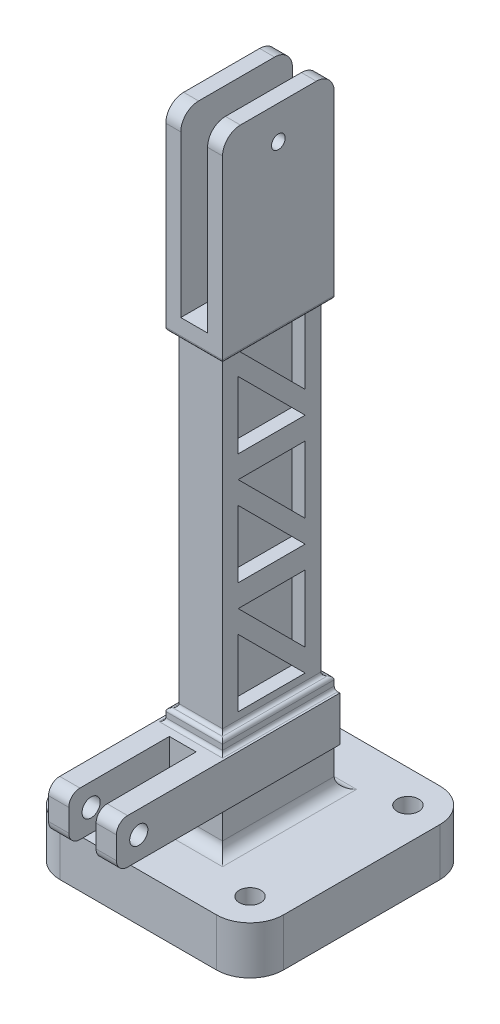
from build123d import *

# Parameters (mm, degrees)
SKETCH1_W               = 50
SKETCH1_H               = 50
BOSS_EXTRUDE1_DEPTH     = 12.7
SKETCH2_R               = 1.53
BOSS_EXTRUDE2_DEPTH     = 6.35
CUT_EXTRUDE2_DEPTH      = 155.110350074
CUT_EXTRUDE2_DEPTH_BACK = 155.110350074
SKETCH3_R               = 2.413
SKETCH4_R               = 2.032
BOSS_EXTRUDE4_DEPTH     = 7.6
CUT_EXTRUDE3_DEPTH      = 12.45
SKETCH6_W               = 6
SKETCH6_H               = 36
SKETCH6_H_2             = 4
CUT_EXTRUDE4_DEPTH      = 157.624551077
BOSS_EXTRUDE5_DEPTH     = 1
SKETCH14_W              = 50
SKETCH14_H              = 50
SKETCH14_W_2            = 12.7
SKETCH14_H_2            = 25
CUT_EXTRUDE9_DEPTH      = 2
CUT_EXTRUDE10_DEPTH     = 4.5
CUT_EXTRUDE6_START      = 22
SKETCH9_OUTSIDE_W       = 86.004
SKETCH9_OUTSIDE_H       = 98.504
SKETCH9_OUTSIDE_W_2     = 9.7
SKETCH9_OUTSIDE_H_2     = 22
CUT_EXTRUDE6_DEPTH      = 73
FILLET5_START           = -13
FILLET5_DEPTH           = 25.5
FILLET5_START_2         = -11.75
FILLET5_2_DEPTH         = 4.25
FILLET5_START_3         = 9.9315
FILLET5_3_DEPTH         = 1.8185
FILLET5_START_4         = 12.5
FILLET5_4_DEPTH         = 0.75
FILLET5_START_5         = -10.0685
FILLET5_5_DEPTH         = 21.268442308
FILLET5_START_6         = -12.5
FILLET5_6_DEPTH         = 25
FILLET5_START_7         = -8
FILLET5_7_DEPTH         = 16
FILLET5_START_8         = -5.6
FILLET5_8_DEPTH         = 0.75
FILLET5_START_9         = 4.85
FILLET5_9_DEPTH         = 0.75
FILLET1_R               = 2.5
FILLET6_R               = 7.5


with BuildPart() as part:
    # Sketch1 → Boss-Extrude1 (new body)
    with BuildSketch(Plane(origin=(0, 0, 0), x_dir=(1, 0, 0), z_dir=(0, 1, 0))):
        Rectangle(SKETCH1_W, SKETCH1_H)
    extrude(amount=BOSS_EXTRUDE1_DEPTH)

    # Sketch2 → Boss-Extrude2 (add, symmetric)
    with BuildSketch(Plane(origin=(0, 0, 0), x_dir=(0, 0, -1), z_dir=(1, 0, 0))):
        with BuildLine():
            Line((-12.5, 0), (12.5, 0))
            Line((12.5, 0), (12.5, 146))
            ThreePointArc((12.5, 146), (11.328427125, 148.828427125), (8.5, 150))
            Line((8.5, 150), (-8.5, 150))
            ThreePointArc((-8.5, 150), (-11.328427125, 148.828427125), (-12.5, 146))
            Line((-12.5, 146), (-12.5, 0))
        make_face()
        with Locations((0, 142.5)):
            Circle(SKETCH2_R, mode=Mode.SUBTRACT)
    extrude(amount=BOSS_EXTRUDE2_DEPTH, both=True)

    # Sketch3 → Cut-Extrude2 (cut, two sides: drawn at the far end of the back side and taken through both)
    with BuildSketch(Plane(origin=(0, 0, 0), x_dir=(1, 0, 0), z_dir=(0, 1, 0)).offset(-CUT_EXTRUDE2_DEPTH_BACK)):
        with Locations(Location((17.67766953, -17.67766953, 0), (0, 0, 270))):
            Circle(SKETCH3_R)
        with Locations(Location((17.67766953, 17.67766953, 0), (0, 0, 270))):
            Circle(SKETCH3_R)
        with Locations(Location((-17.67766953, 17.67766953, 0), (0, 0, 270))):
            Circle(SKETCH3_R)
        with Locations(Location((-17.67766953, -17.67766953, 0), (0, 0, 270))):
            Circle(SKETCH3_R)
    extrude(amount=CUT_EXTRUDE2_DEPTH + CUT_EXTRUDE2_DEPTH_BACK, mode=Mode.SUBTRACT)

    # Sketch4 → Boss-Extrude4 (add, symmetric)
    with BuildSketch(Plane(origin=(0, 0, 0), x_dir=(0, 0, -1), z_dir=(1, 0, 0))):
        with BuildLine():
            Line((12.5, 20), (-35, 20))
            ThreePointArc((-35, 20), (-36.767766953, 20.732233047), (-37.5, 22.5))
            Line((-37.5, 22.5), (-37.5, 27.5))
            ThreePointArc((-37.5, 27.5), (-36.767766953, 29.267766953), (-35, 30))
            Line((-35, 30), (12.5, 30))
            Line((12.5, 30), (12.5, 20))
        make_face()
        with Locations(Location((-32.5, 25, 0), (0, 0, 180))):
            Circle(SKETCH4_R, mode=Mode.SUBTRACT)
    extrude(amount=BOSS_EXTRUDE4_DEPTH, both=True)

    # Sketch5 → Cut-Extrude3 (cut)
    with BuildSketch(Plane(origin=(0, 30, 0), x_dir=(1, 0, 0), z_dir=(0, 1, 0))):
        Polygon((-3.070505438, -14.989300838), (-3.070505438, -44.384490964), (3.070505438, -44.384490964), (2.929494562, -14.989300838), align=None)
    extrude(amount=-CUT_EXTRUDE3_DEPTH, mode=Mode.SUBTRACT)

    # Sketch6 → Cut-Extrude4 (cut, through all)
    with BuildSketch(Plane.XY.offset(12.5)):
        with Locations((0, 128)):
            Rectangle(SKETCH6_W, SKETCH6_H)
        with Locations((0, 148)):
            Rectangle(SKETCH6_W, SKETCH6_H_2)
    extrude(amount=-CUT_EXTRUDE4_DEPTH, mode=Mode.SUBTRACT)

    # Sketch7 → Boss-Extrude5 (add)
    # profile 1 of 2: a face of its own
    with BuildSketch(Plane(origin=(-7.6, 17.6, 0), x_dir=(0, 1, 0), z_dir=(-1, 0, 0))):
        Polygon((8.560466437, 8.088778045), (8.560466437, 7.508205128), (5.420466437, 7.508205128), (5.420466437, 7.79), (8.238415155, 7.79), (8.238415155, 8.273076923), align=None)
    # profile 2 of 2: a face of its own
    with BuildSketch(Plane(origin=(-7.6, 17.6, 0), x_dir=(0, 1, 0), z_dir=(-1, 0, 0))):
        with BuildLine():
            Line((8.640979257, 4.891538462), (8.47051852, 4.67453125))
            Line((8.47051852, 4.67453125), (7.20181259, 5.504190705))
            add(Edge.make_bspline(
                [(7.20181259, 5.504190705), (7.210617025, 5.448953371), (7.227791071, 5.341206705), (7.2306242, 5.232144728), (7.232004898, 5.178994391)],
                knots=[0, 0, 0, 0, 1.025318673, 2, 2, 2, 2], degree=3))
            add(Edge.make_bspline(
                [(7.232004898, 5.178994391), (7.231147129, 5.14708078), (7.229458637, 5.084259786), (7.216464554, 4.992027398), (7.195987168, 4.90339961), (7.166137201, 4.818743764), (7.128006517, 4.737756003), (7.082307074, 4.659971567), (7.02667912, 4.586852621), (6.96453856, 4.517457563), (6.895712465, 4.454453824), (6.822683838, 4.39867302), (6.745528762, 4.351818127), (6.664286316, 4.313802666), (6.579081735, 4.284282289), (6.490024032, 4.262761945), (6.397051798, 4.250040824), (6.333822806, 4.248313384), (6.301704417, 4.247435897)],
                knots=[0, 0, 0, 0, 1.04369286, 2.054478336, 3.041073146, 4.015093852, 4.984733326, 5.965804835, 6.960378782, 7.985147595, 9.009457201, 10.008161701, 10.986880575, 11.956520048, 12.937015923, 13.931873656, 14.949455224, 16, 16, 16, 16], degree=3))
            add(Edge.make_bspline(
                [(6.301704417, 4.247435897), (6.257788747, 4.249074555), (6.171424054, 4.252297143), (6.04510866, 4.275756216), (5.925736546, 4.316241336), (5.8128386, 4.370405571), (5.709699594, 4.440679408), (5.61648959, 4.523957767), (5.535243379, 4.621027863), (5.465545639, 4.729591055), (5.410170872, 4.847090143), (5.369231176, 4.970291781), (5.344768668, 5.098142907), (5.341566016, 5.184971413), (5.339953616, 5.228685897)],
                knots=[0, 0, 0, 0, 1.031881447, 2.029301251, 3.006342947, 3.987068354, 4.962916383, 5.929513747, 6.915671209, 7.928552063, 8.953527267, 9.960179832, 10.973036711, 12, 12, 12, 12], degree=3))
            add(Edge.make_bspline(
                [(5.339953616, 5.228685897), (5.341324631, 5.270938374), (5.344040373, 5.354633133), (5.368232722, 5.477750435), (5.407444046, 5.59605085), (5.461465577, 5.708702825), (5.529697679, 5.813065349), (5.611852019, 5.906403803), (5.706112889, 5.988393443), (5.812769449, 6.056266358), (5.926640798, 6.111582969), (6.046458192, 6.150598574), (6.169810259, 6.175830068), (6.253777457, 6.178433248), (6.29604336, 6.17974359)],
                knots=[0, 0, 0, 0, 1.011913813, 2.004424092, 2.994488568, 3.992479987, 4.990471406, 5.973328987, 6.963763268, 7.974390938, 8.994854117, 9.989689954, 10.988086187, 12, 12, 12, 12], degree=3))
            add(Edge.make_bspline(
                [(6.29604336, 6.17974359), (6.328368726, 6.17860561), (6.394341577, 6.176283108), (6.494548343, 6.162422681), (6.596679591, 6.137000965), (6.683258949, 6.109489112), (6.754962343, 6.082189049), (6.811584619, 6.056875802), (6.871379561, 6.028572508), (6.93321579, 5.995397106), (6.998860099, 5.960228502), (7.065881481, 5.919147582), (7.136727763, 5.876279011), (7.183896117, 5.844874588), (7.208102655, 5.828758013)],
                knots=[0, 0, 0, 0, 1.17367173, 2.395347028, 3.66355231, 4.98980831, 5.690886799, 6.447442954, 7.240630024, 8.091733897, 8.994365608, 9.943299771, 10.944512865, 12, 12, 12, 12], degree=3))
            Line((7.208102655, 5.828758013), (8.640979257, 4.891538462))
        make_face()
        with BuildLine():
            add(Edge.make_bspline(
                [(6.909953616, 5.238120994), (6.909246353, 5.262040086), (6.907858709, 5.308969147), (6.900021286, 5.377734009), (6.885171517, 5.442639763), (6.865962999, 5.50442774), (6.839809258, 5.562453947), (6.808417354, 5.617380289), (6.771094432, 5.668661739), (6.728256634, 5.715397705), (6.682040535, 5.758312865), (6.632242388, 5.79522691), (6.580383613, 5.82710369), (6.525976801, 5.853012669), (6.469056852, 5.873190054), (6.409881813, 5.887784843), (6.348055881, 5.895907394), (6.306130144, 5.897258693), (6.284721244, 5.897948718)],
                knots=[0, 0, 0, 0, 1.129474985, 2.216020618, 3.260639938, 4.268601163, 5.26556745, 6.258792394, 7.250684778, 8.252748164, 9.247500881, 10.223461414, 11.174097059, 12.117127289, 13.062595836, 14.020469732, 14.98917545, 16, 16, 16, 16], degree=3))
            add(Edge.make_bspline(
                [(6.284721244, 5.897948718), (6.263504641, 5.897385334), (6.221902042, 5.896280623), (6.16058051, 5.886296061), (6.10162322, 5.870935659), (6.044987051, 5.8484521), (5.990980944, 5.820251144), (5.939221278, 5.785546758), (5.889672327, 5.74492657), (5.84358354, 5.697706408), (5.801309785, 5.646784042), (5.763669153, 5.592930267), (5.732061088, 5.536316316), (5.707072421, 5.476619147), (5.686606107, 5.414674565), (5.672193823, 5.350010016), (5.664048063, 5.282568683), (5.662694892, 5.236884505), (5.662004898, 5.213589744)],
                knots=[0, 0, 0, 0, 0.989642335, 1.94054129, 2.892446913, 3.828371744, 4.778262963, 5.730973156, 6.732161388, 7.763274768, 8.805796303, 9.818398792, 10.825975928, 11.825728216, 12.834635236, 13.867465554, 14.912602056, 16, 16, 16, 16], degree=3))
            add(Edge.make_bspline(
                [(5.662004898, 5.213589744), (5.662694838, 5.190294944), (5.664047903, 5.144610691), (5.672194432, 5.077169901), (5.686603873, 5.012503346), (5.707080519, 4.950566053), (5.732031047, 4.890841977), (5.763867214, 4.834178471), (5.801080927, 4.779810535), (5.843656298, 4.728921575), (5.889411904, 4.681504046), (5.93966991, 4.641835272), (5.990569566, 4.606034496), (6.045202263, 4.578916659), (6.101589126, 4.556182704), (6.160589644, 4.540899801), (6.22189965, 4.530894577), (6.263503834, 4.529792705), (6.284721244, 4.529230769)],
                knots=[0, 0, 0, 0, 1.087205562, 2.132157158, 3.164804748, 4.173533273, 5.173108684, 6.180507559, 7.20098426, 8.243321352, 9.274252308, 10.269075238, 11.227079059, 12.172305571, 13.108064818, 14.05980203, 15.010532752, 16, 16, 16, 16], degree=3))
            add(Edge.make_bspline(
                [(6.284721244, 4.529230769), (6.306160558, 4.529718706), (6.348238959, 4.530676369), (6.40982611, 4.541717812), (6.469538043, 4.55663112), (6.52602965, 4.580732391), (6.580863152, 4.609438973), (6.632471365, 4.646009273), (6.68231636, 4.687938016), (6.728563146, 4.73649557), (6.770864221, 4.789321841), (6.808202008, 4.84549873), (6.839714367, 4.904268277), (6.866006961, 4.965573709), (6.884981078, 5.030116719), (6.899921411, 5.096855489), (6.907871908, 5.16664355), (6.909250875, 5.213991708), (6.909953616, 5.238120994)],
                knots=[0, 0, 0, 0, 0.978265087, 1.920016216, 2.851775529, 3.783928695, 4.718195979, 5.674835085, 6.667117013, 7.690134047, 8.732874136, 9.755756613, 10.767227014, 11.776017537, 12.797239016, 13.836276431, 14.897336092, 16, 16, 16, 16], degree=3))
        make_face(mode=Mode.SUBTRACT)
    extrude(amount=BOSS_EXTRUDE5_DEPTH)

    # Sketch14 → Cut-Extrude9 (cut)
    with BuildSketch(Plane(origin=(0, 12.7, 0), x_dir=(1, 0, 0), z_dir=(0, 1, 0))):
        Rectangle(SKETCH14_W, SKETCH14_H)
        Rectangle(SKETCH14_W_2, SKETCH14_H_2, mode=Mode.SUBTRACT)
    extrude(amount=-CUT_EXTRUDE9_DEPTH, mode=Mode.SUBTRACT)

    # Sketch16 → Cut-Extrude10 (cut)
    with BuildSketch(Plane(origin=(6.35, 0, 0), x_dir=(0, 0, -1), z_dir=(1, 0, 0))):
        Polygon((-7.5, 105), (7.5, 105), (7.5, 90), align=None)
        Polygon((-7.5, 100), (-7.5, 85), (7.5, 85), align=None)
        Polygon((-7.5, 80), (7.5, 80), (7.5, 65), align=None)
        Polygon((-7.5, 75), (-7.5, 60), (7.5, 60), align=None)
        Polygon((7.5, 55), (-7.5, 55), (7.5, 40), align=None)
        Polygon((-7.5, 50), (7.5, 35), (-7.5, 35), align=None)
    cut_extrude10 = extrude(amount=-CUT_EXTRUDE10_DEPTH, mode=Mode.SUBTRACT)

    # Mirror1: Cut-Extrude10 across plane
    add(cut_extrude10.mirror(Plane(origin=(0, 0, 0), x_dir=(0, 0, 1), z_dir=(1, 0, 0))), mode=Mode.SUBTRACT)

    # Sketch9 outside → Cut-Extrude6 (cut)
    with BuildSketch(Plane(origin=(0, 10.7, 0), x_dir=(1, 0, 0), z_dir=(0, 1, 0)).offset(CUT_EXTRUDE6_START)):
        with Locations((0, -6.25)):
            Rectangle(SKETCH9_OUTSIDE_W, SKETCH9_OUTSIDE_H)
        Rectangle(SKETCH9_OUTSIDE_W_2, SKETCH9_OUTSIDE_H_2, mode=Mode.SUBTRACT)
    extrude(amount=CUT_EXTRUDE6_DEPTH, mode=Mode.SUBTRACT)

    # Fillet5: read off the stored shape, not the designer's step
    # Fillet5 outline → Fillet5 (cut)
    with BuildSketch(Plane.XY.offset(FILLET5_START)):
        with BuildLine():
            Line((-6.35, 105.7), (-5.6, 105.7))
            ThreePointArc((-5.6, 105.7), (-6.130330086, 105.919669914), (-6.35, 106.45))
            Line((-6.35, 106.45), (-6.35, 105.7))
        make_face()
        with BuildLine():
            ThreePointArc((6.35, 106.45), (6.130330086, 105.919669914), (5.6, 105.7))
            Line((5.6, 105.7), (6.35, 105.7))
            Line((6.35, 105.7), (6.35, 106.45))
        make_face()
        with BuildLine():
            ThreePointArc((-6.35, 31.95), (-6.130330086, 32.480330086), (-5.6, 32.7))
            Line((-5.6, 32.7), (-6.35, 32.7))
            Line((-6.35, 32.7), (-6.35, 31.95))
        make_face()
        with BuildLine():
            Line((6.35, 32.7), (5.6, 32.7))
            ThreePointArc((5.6, 32.7), (6.130330086, 32.480330086), (6.35, 31.95))
            Line((6.35, 31.95), (6.35, 32.7))
        make_face()
    extrude(amount=FILLET5_DEPTH, mode=Mode.SUBTRACT)

    # Fillet5 2 outline → Fillet5 2 (add)
    with BuildSketch(Plane.XY.offset(FILLET5_START_2)):
        with BuildLine():
            ThreePointArc((-5.6, 105.7), (-5.069669914, 105.480330086), (-4.85, 104.95))
            Line((-4.85, 104.95), (-4.85, 33.45))
            ThreePointArc((-4.85, 33.45), (-5.069669914, 32.919669914), (-5.6, 32.7))
            Line((-5.6, 32.7), (5.6, 32.7))
            ThreePointArc((5.6, 32.7), (5.069669914, 32.919669914), (4.85, 33.45))
            Line((4.85, 33.45), (4.85, 104.95))
            ThreePointArc((4.85, 104.95), (5.069669914, 105.480330086), (5.6, 105.7))
            Line((5.6, 105.7), (-5.6, 105.7))
        make_face()
        with BuildLine():
            Line((-6.35, 30), (-6.35, 30.75))
            ThreePointArc((-6.35, 30.75), (-6.569669914, 30.219669914), (-7.1, 30))
            Line((-7.1, 30), (-6.35, 30))
        make_face()
        with BuildLine():
            Line((6.35, 30.75), (6.35, 30))
            Line((6.35, 30), (7.1, 30))
            ThreePointArc((7.1, 30), (6.569669914, 30.219669914), (6.35, 30.75))
        make_face()
    extrude(amount=FILLET5_2_DEPTH)

    # Fillet5 3 outline → Fillet5 3 (add)
    with BuildSketch(Plane.XY.offset(FILLET5_START_3)):
        with BuildLine():
            ThreePointArc((-5.6, 105.7), (-5.087652462, 105.497722558), (-4.851668523, 105))
            Line((-4.851668523, 105), (-4.85, 105))
            Line((-4.85, 105), (-4.85, 33.45))
            ThreePointArc((-4.85, 33.45), (-5.069669914, 32.919669914), (-5.6, 32.7))
            Line((-5.6, 32.7), (5.6, 32.7))
            ThreePointArc((5.6, 32.7), (5.069669914, 32.919669914), (4.85, 33.45))
            Line((4.85, 33.45), (4.85, 105))
            Line((4.85, 105), (4.851668523, 105))
            ThreePointArc((4.851668523, 105), (5.087652462, 105.497722558), (5.6, 105.7))
            Line((5.6, 105.7), (-5.6, 105.7))
        make_face()
        with BuildLine():
            Line((-6.35, 30), (-6.35, 30.75))
            ThreePointArc((-6.35, 30.75), (-6.569669914, 30.219669914), (-7.1, 30))
            Line((-7.1, 30), (-6.35, 30))
        make_face()
        with BuildLine():
            Line((6.35, 30.75), (6.35, 30))
            Line((6.35, 30), (7.1, 30))
            ThreePointArc((7.1, 30), (6.569669914, 30.219669914), (6.35, 30.75))
        make_face()
    extrude(amount=FILLET5_3_DEPTH)

    # Fillet5 4 outline → Fillet5 4 (add)
    with BuildSketch(Plane.XY.offset(FILLET5_START_4)):
        with BuildLine():
            ThreePointArc((-5.6, 32.7), (-6.130330086, 32.480330086), (-6.35, 31.95))
            Line((-6.35, 31.95), (-6.35, 30.75))
            ThreePointArc((-6.35, 30.75), (-6.569669914, 30.219669914), (-7.1, 30))
            Line((-7.1, 30), (7.1, 30))
            ThreePointArc((7.1, 30), (6.569669914, 30.219669914), (6.35, 30.75))
            Line((6.35, 30.75), (6.35, 31.95))
            ThreePointArc((6.35, 31.95), (6.130330086, 32.480330086), (5.6, 32.7))
            Line((5.6, 32.7), (-5.6, 32.7))
        make_face()
    extrude(amount=FILLET5_4_DEPTH)

    # Fillet5 5 outline → Fillet5 5 (add)
    with BuildSketch(Plane.XY.offset(FILLET5_START_5)):
        with BuildLine():
            Line((-4.85, 105.7), (-5.6, 105.7))
            ThreePointArc((-5.6, 105.7), (-5.069669914, 105.480330086), (-4.85, 104.95))
            Line((-4.85, 104.95), (-4.85, 105.7))
        make_face()
        with BuildLine():
            Line((5.6, 105.7), (4.85, 105.7))
            Line((4.85, 105.7), (4.85, 104.95))
            ThreePointArc((4.85, 104.95), (5.069669914, 105.480330086), (5.6, 105.7))
        make_face()
        with BuildLine():
            Line((-4.85, 32.7), (-4.85, 33.45))
            ThreePointArc((-4.85, 33.45), (-5.069669914, 32.919669914), (-5.6, 32.7))
            Line((-5.6, 32.7), (-4.85, 32.7))
        make_face()
        with BuildLine():
            Line((4.85, 33.45), (4.85, 32.7))
            Line((4.85, 32.7), (5.6, 32.7))
            ThreePointArc((5.6, 32.7), (5.069669914, 32.919669914), (4.85, 33.45))
        make_face()
        with BuildLine():
            Line((-6.35, 30), (-6.35, 30.75))
            ThreePointArc((-6.35, 30.75), (-6.569669914, 30.219669914), (-7.1, 30))
            Line((-7.1, 30), (-6.35, 30))
        make_face()
        with BuildLine():
            Line((6.35, 30.75), (6.35, 30))
            Line((6.35, 30), (7.1, 30))
            ThreePointArc((7.1, 30), (6.569669914, 30.219669914), (6.35, 30.75))
        make_face()
    extrude(amount=FILLET5_5_DEPTH)

    # Fillet5 6 outline → Fillet5 6 (add)
    with BuildSketch(Plane.XY.offset(FILLET5_START_6)):
        with BuildLine():
            Line((-6.35, 30), (-6.35, 30.75))
            ThreePointArc((-6.35, 30.75), (-6.569669914, 30.219669914), (-7.1, 30))
            Line((-7.1, 30), (-6.35, 30))
        make_face()
        with BuildLine():
            Line((6.35, 30.75), (6.35, 30))
            Line((6.35, 30), (7.1, 30))
            ThreePointArc((7.1, 30), (6.569669914, 30.219669914), (6.35, 30.75))
        make_face()
    extrude(amount=FILLET5_6_DEPTH)

    # Fillet5 7 outline → Fillet5 7 (cut)
    with BuildSketch(Plane.YZ.offset(FILLET5_START_7)):
        with BuildLine():
            ThreePointArc((30, 13.25), (30.219669914, 12.719669914), (30.75, 12.5))
            Line((30.75, 12.5), (31.95, 12.5))
            ThreePointArc((31.95, 12.5), (32.480330086, 12.280330086), (32.7, 11.75))
            Line((32.7, 11.75), (32.7, 13.25))
            Line((32.7, 13.25), (30, 13.25))
        make_face()
        with BuildLine():
            Line((105.7, 12.5), (105.7, 11.75))
            ThreePointArc((105.7, 11.75), (105.919669914, 12.280330086), (106.45, 12.5))
            Line((106.45, 12.5), (105.7, 12.5))
        make_face()
        with BuildLine():
            Line((105, 11.75), (32.7, 11.75))
            ThreePointArc((32.7, 11.75), (32.919669914, 11.219669914), (33.45, 11))
            Line((33.45, 11), (104.95, 11))
            ThreePointArc((104.95, 11), (105.480330086, 11.219669914), (105.7, 11.75))
            Line((105.7, 11.75), (105, 11.75))
        make_face()
        with BuildLine():
            ThreePointArc((105.7, -11.75), (105.480330086, -11.219669914), (104.95, -11))
            Line((104.95, -11), (33.45, -11))
            ThreePointArc((33.45, -11), (32.919669914, -11.219669914), (32.7, -11.75))
            Line((32.7, -11.75), (105.7, -11.75))
        make_face()
        with BuildLine():
            ThreePointArc((106.45, -12.5), (105.919669914, -12.280330086), (105.7, -11.75))
            Line((105.7, -11.75), (105.7, -12.5))
            Line((105.7, -12.5), (106.45, -12.5))
        make_face()
        with BuildLine():
            Line((32.7, -12.5), (32.7, -11.75))
            ThreePointArc((32.7, -11.75), (32.480330086, -12.280330086), (31.95, -12.5))
            Line((31.95, -12.5), (32.7, -12.5))
        make_face()
    extrude(amount=FILLET5_7_DEPTH, mode=Mode.SUBTRACT)

    # Fillet5 8 outline → Fillet5 8 (cut)
    with BuildSketch(Plane.YZ.offset(FILLET5_START_8)):
        Polygon((90, -7.5), (105, -7.5), (105, 7.5), align=None)
    extrude(amount=FILLET5_8_DEPTH, mode=Mode.SUBTRACT)

    # Fillet5 9 outline → Fillet5 9 (cut)
    with BuildSketch(Plane.YZ.offset(FILLET5_START_9)):
        Polygon((90, -7.5), (105, -7.5), (105, 7.5), align=None)
    extrude(amount=FILLET5_9_DEPTH, mode=Mode.SUBTRACT)

    # Fillet1
    fillet1_edges = [part.edges().sort_by_distance(p)[0] for p in [
        (0, 10.7, 12.5),
        (6.35, 10.7, 0),
        (0, 10.7, -12.5),
        (-6.35, 10.7, 0),
    ]]
    fillet(fillet1_edges, radius=FILLET1_R)

    # Fillet6
    fillet6_edges = [part.edges().sort_by_distance(p)[0] for p in [
        (-25, 5.35, -25),
        (25, 5.35, -25),
        (25, 5.35, 25),
        (-25, 5.35, 25),
    ]]
    fillet(fillet6_edges, radius=FILLET6_R)


solid = part.part
